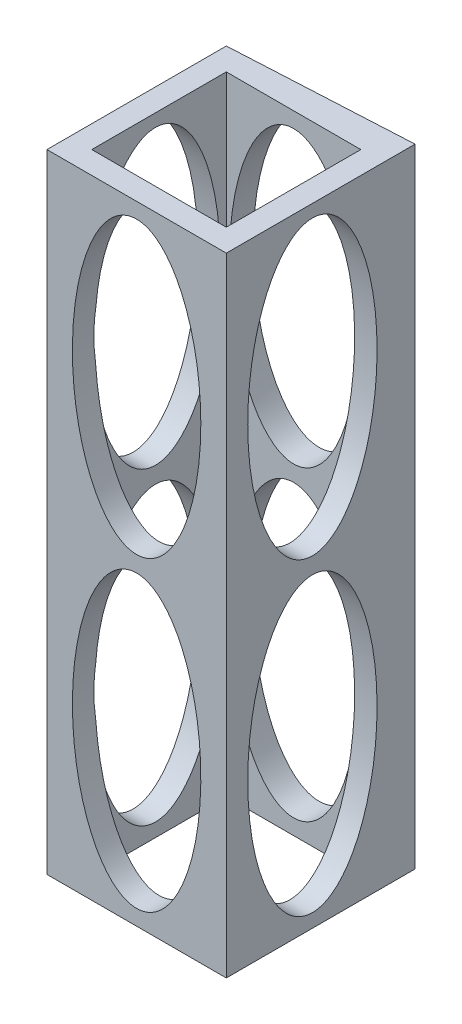
from build123d import *

# Parameters (mm, degrees)
SKETCH1_W           = 30
SKETCH1_H           = 30
BOSS_EXTRUDE1_DEPTH = 140
SKETCH2_RX          = 32.388825172
SKETCH2_RY          = 14.31894833
CUT_EXTRUDE1_DEPTH  = 140
CUT_EXTRUDE2_START  = -40
CUT_EXTRUDE2_DEPTH  = 40


# Read off the part's stored shape, not the designer's step: Cut-Extrude2
with BuildPart() as part:
    # Sketch1 → Boss-Extrude1 (new body)
    with BuildSketch(Plane(origin=(0, 0, 0), x_dir=(1, 0, 0), z_dir=(0, 1, 0))):
        Polygon((0.443688617, 22.529586441), (-39.556311383, 20.43327527), (-39.556311383, -19.56672473), (0.443688617, -19.56672473), (0.443688617, 20.43327527), align=None)
        with Locations((-19.556311383, 0.43327527)):
            Rectangle(SKETCH1_W, SKETCH1_H, mode=Mode.SUBTRACT)
    extrude(amount=BOSS_EXTRUDE1_DEPTH)

    # Sketch2 → Cut-Extrude1 (cut)
    with BuildSketch(Plane.XY.offset(19.56672473)):
        with Locations(Location((-19.556311383, 35.826899406), (0, 0, 90))):
            Ellipse(SKETCH2_RX, SKETCH2_RY)
        with Locations(Location((-19.556311383, 104.173100594), (0, 0, -90))):
            Ellipse(SKETCH2_RX, SKETCH2_RY)
    extrude(amount=-CUT_EXTRUDE1_DEPTH, mode=Mode.SUBTRACT)

    # Cut-Extrude2 outline → Cut-Extrude2 (cut)
    with BuildSketch(Plane.ZY.offset(39.556311383).offset(CUT_EXTRUDE2_START)):
        with BuildLine():
            add(Edge.make_bspline(
                [(0.36415021, 68.265646026), (-24.612902461, 68.265646026), (-12.124376125, 19.337822791), (0.36415021, -29.590000445), (12.852676546, 19.337822791), (25.341202882, 68.265646026), (0.36415021, 68.265646026)],
                knots=[0, 0, 0, 2.094395102, 2.094395102, 4.188790205, 4.188790205, 6.283185307, 6.283185307, 6.283185307], degree=2, weights=[1, 0.5, 1, 0.5, 1, 0.5, 1]))
        make_face()
        with BuildLine():
            add(Edge.make_bspline(
                [(0.36415021, 71.935232769), (25.341202882, 71.935232769), (12.852676546, 120.863056005), (0.36415021, 169.79087924), (-12.124376125, 120.863056005), (-24.612902461, 71.935232769), (0.36415021, 71.935232769)],
                knots=[0, 0, 0, 2.094395102, 2.094395102, 4.188790205, 4.188790205, 6.283185307, 6.283185307, 6.283185307], degree=2, weights=[1, 0.5, 1, 0.5, 1, 0.5, 1]))
        make_face()
    extrude(amount=CUT_EXTRUDE2_DEPTH, mode=Mode.SUBTRACT)


solid = part.part
